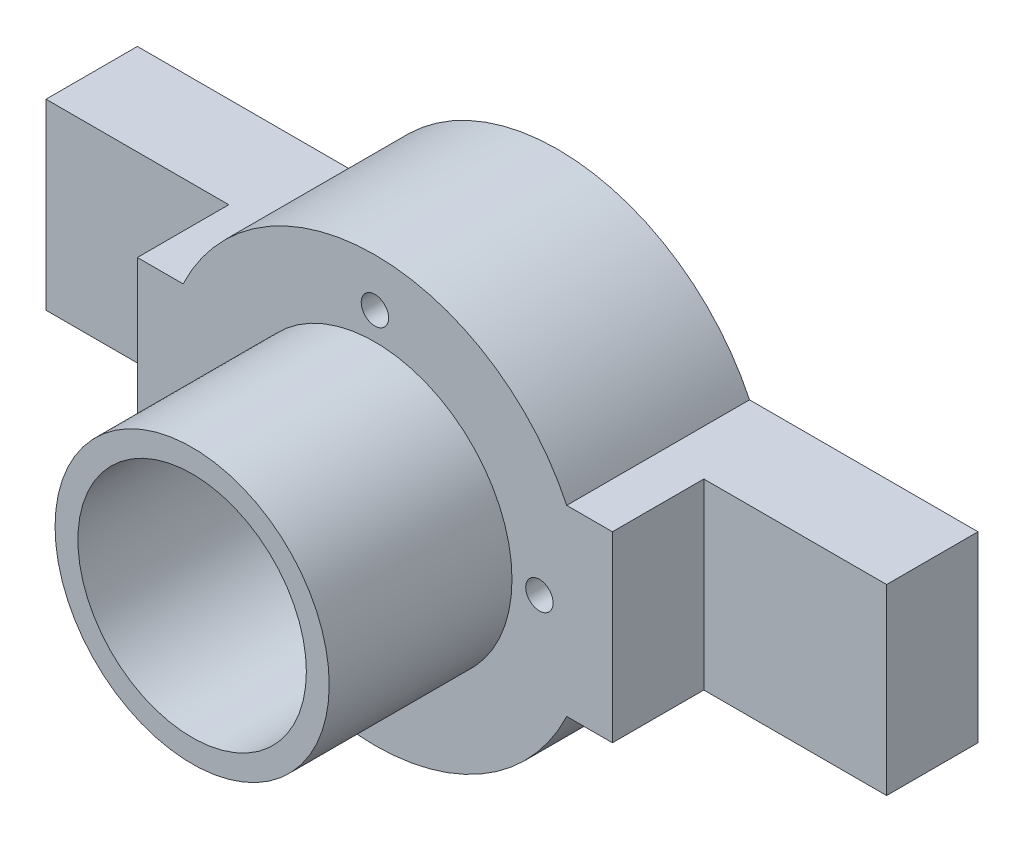
from build123d import *

# Parameters (mm, degrees)
CROQUIS1_R              = 15
CROQUIS1_R_2            = 12.5
SALIENTE_EXTRUIR1_DEPTH = 20
CROQUIS8_R              = 23.25
CROQUIS8_R_2            = 1.5
SALIENTE_EXTRUIR2_DEPTH = 20
CROQUIS10_W             = 25
CROQUIS10_H             = 20
SALIENTE_EXTRUIR6_DEPTH = 20
CROQUIS11_W             = 20
CROQUIS11_H             = 20
CORTAR_EXTRUIR2_DEPTH   = 10


with BuildPart() as part:
    # Croquis1 → Saliente-Extruir1 (new body)
    with BuildSketch(Plane.XY):
        Circle(CROQUIS1_R)
        Circle(CROQUIS1_R_2, mode=Mode.SUBTRACT)
    extrude(amount=-SALIENTE_EXTRUIR1_DEPTH)

    # Croquis8 → Saliente-Extruir2 (add)
    with BuildSketch(Plane(origin=(0, 0, -20), x_dir=(-1, 0, 0), z_dir=(0, 0, -1))):
        Circle(CROQUIS8_R)
        with Locations((0, 18)):
            Circle(CROQUIS8_R_2, mode=Mode.SUBTRACT)
        with Locations((18, 0)):
            Circle(CROQUIS8_R_2, mode=Mode.SUBTRACT)
        with Locations((0, -18)):
            Circle(CROQUIS8_R_2, mode=Mode.SUBTRACT)
        with Locations((-18, 0)):
            Circle(CROQUIS8_R_2, mode=Mode.SUBTRACT)
    extrude(amount=SALIENTE_EXTRUIR2_DEPTH)

    # Croquis10 → Saliente-Extruir6 (add)
    with BuildSketch(Plane(origin=(0, 0, -40), x_dir=(-1, 0, 0), z_dir=(0, 0, -1))):
        with Locations((-33.489580749, 0)):
            Rectangle(CROQUIS10_W, CROQUIS10_H)
        with Locations((33.489580749, 0)):
            Rectangle(CROQUIS10_W, CROQUIS10_H)
    extrude(amount=-SALIENTE_EXTRUIR6_DEPTH)

    # Croquis11 → Cortar-Extruir2 (cut)
    with BuildSketch(Plane(origin=(0, 0, -20), x_dir=(-1, 0, 0), z_dir=(0, 0, -1))):
        with Locations((-35.989580749, 0)):
            Rectangle(CROQUIS11_W, CROQUIS11_H)
        with Locations((35.989580749, 0)):
            Rectangle(CROQUIS11_W, CROQUIS11_H)
    extrude(amount=CORTAR_EXTRUIR2_DEPTH, mode=Mode.SUBTRACT)


solid = part.part
